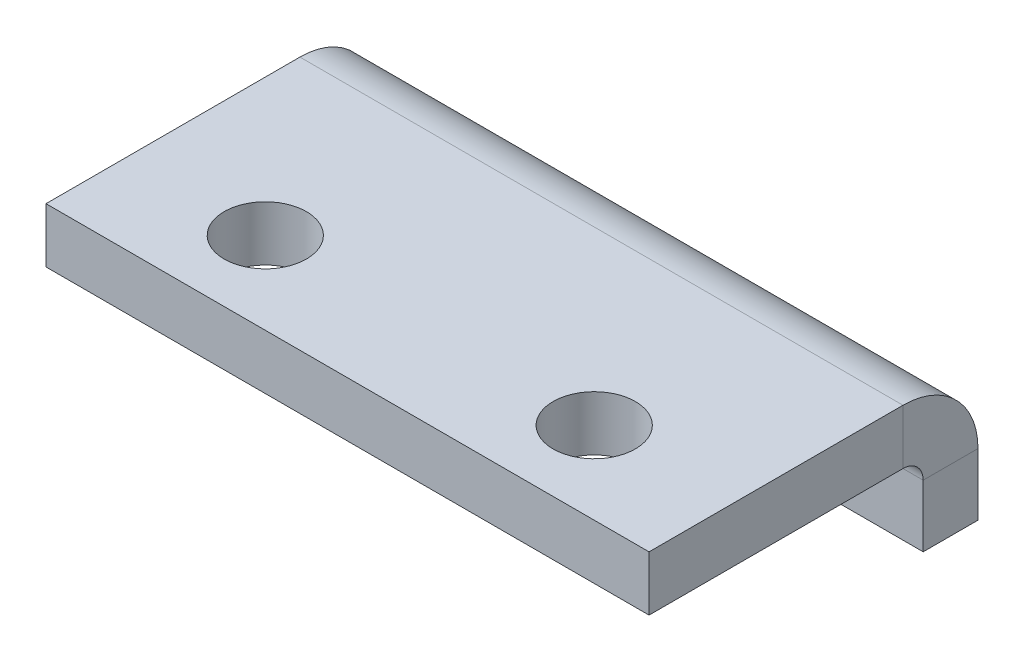
from build123d import *

# Parameters (mm, degrees)
SKETCH1_W                    = 12
SKETCH1_H                    = 2
BASE_FLANGE1_DEPTH           = 11
SKETCH2_R                    = 1.5
CUT_EXTRUDE1_DEPTH           = 10
EDGE_FLANGE1_STRIP_W         = 9.4732
EDGE_FLANGE1_STRIP_H         = 2
EDGE_FLANGE1_STRIP_CUT_DEPTH = 22
EDGE_FLANGE1_DEPTH           = 22


# Sheet-metal steps are written as plain solids
with BuildPart() as part:
    # Sketch1 → Base-Flange1 (new, symmetric)
    with BuildSketch(Plane(origin=(0, 0, 0), x_dir=(0, 0, -1), z_dir=(1, 0, 0))):
        with Locations((6, -1)):
            Rectangle(SKETCH1_W, SKETCH1_H)
    extrude(amount=BASE_FLANGE1_DEPTH, both=True)

    # Sketch2 → Cut-Extrude1 (cut)
    with BuildSketch(Plane(origin=(0, 0, 0), x_dir=(1, 0, 0), z_dir=(0, 1, 0))):
        with Locations(Location((-6, 3, 0), (0, 0, 270))):
            Circle(SKETCH2_R)
        with Locations(Location((6, 3, 0), (0, 0, 270))):
            Circle(SKETCH2_R)
    extrude(amount=-CUT_EXTRUDE1_DEPTH, mode=Mode.SUBTRACT)

    # Edge-Flange1 strip (across the edge) → Edge-Flange1 strip cut (cut)
    with BuildSketch(Plane(origin=(-11, -2, -12), x_dir=(0, 0, 1), z_dir=(1, 0, 0))):
        with Locations((-2, -1)):
            Rectangle(EDGE_FLANGE1_STRIP_W, EDGE_FLANGE1_STRIP_H)
    extrude(amount=EDGE_FLANGE1_STRIP_CUT_DEPTH, mode=Mode.SUBTRACT)

    # Edge-Flange1 section (across the edge) → Edge-Flange1 (add)
    with BuildSketch(Plane(origin=(-11, -2, -12), x_dir=(0, 0, 1), z_dir=(1, 0, 0))):
        with BuildLine():
            Line((0, 0.7366), (0, 3))
            Line((0, 3), (2, 3))
            Line((2, 3), (2, 0.7366))
            ThreePointArc((2, 0.7366), (2.215745145, 0.215745145), (2.7366, 0))
            Line((2.7366, 0), (2.7366, -2))
            ThreePointArc((2.7366, -2), (0.801531583, -1.198468417), (0, 0.7366))
        make_face()
    extrude(amount=EDGE_FLANGE1_DEPTH)


solid = part.part
